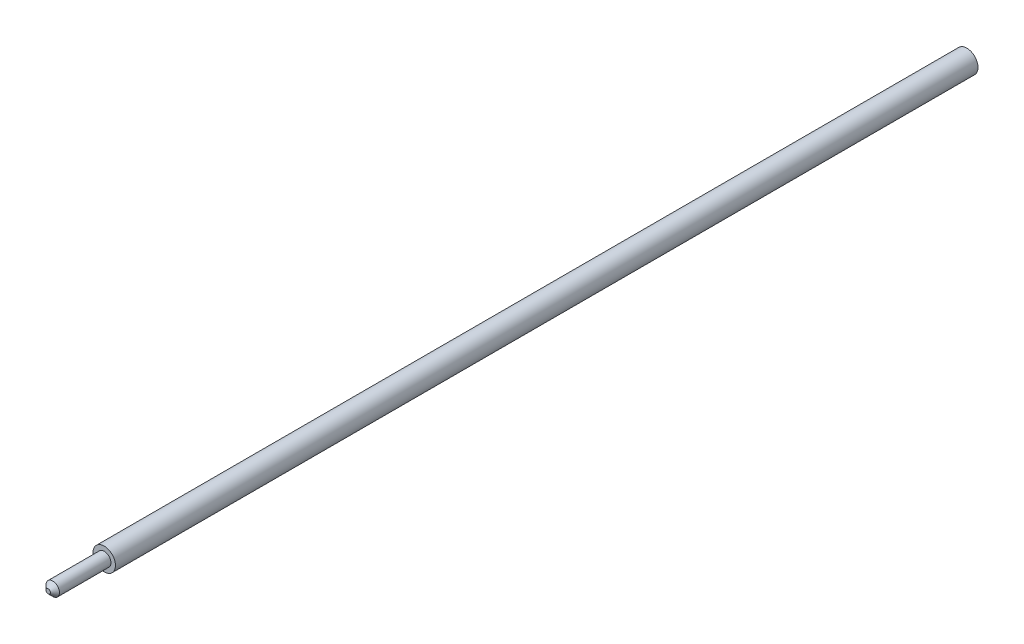
from build123d import *

# Parameters (mm, degrees)
SKETCH1_R           = 1.27
BOSS_EXTRUDE1_DEPTH = 97.79
SKETCH3_R           = 0.762
BOSS_EXTRUDE2_DEPTH = 6.35
CHAMFER1_SIZE       = 0.508


with BuildPart() as part:
    # Sketch1 → Boss-Extrude1 (new body)
    with BuildSketch(Plane.XY):
        Circle(SKETCH1_R)
    extrude(amount=BOSS_EXTRUDE1_DEPTH)

    # Sketch3 → Boss-Extrude2 (add)
    with BuildSketch(Plane.XY.offset(97.79)):
        Circle(SKETCH3_R)
    extrude(amount=BOSS_EXTRUDE2_DEPTH)

    # Chamfer1
    chamfer1_edges = [part.edges().sort_by_distance(p)[0] for p in [
        (-0.762, 0, 104.14),
    ]]
    chamfer(chamfer1_edges, length=CHAMFER1_SIZE)


solid = part.part
